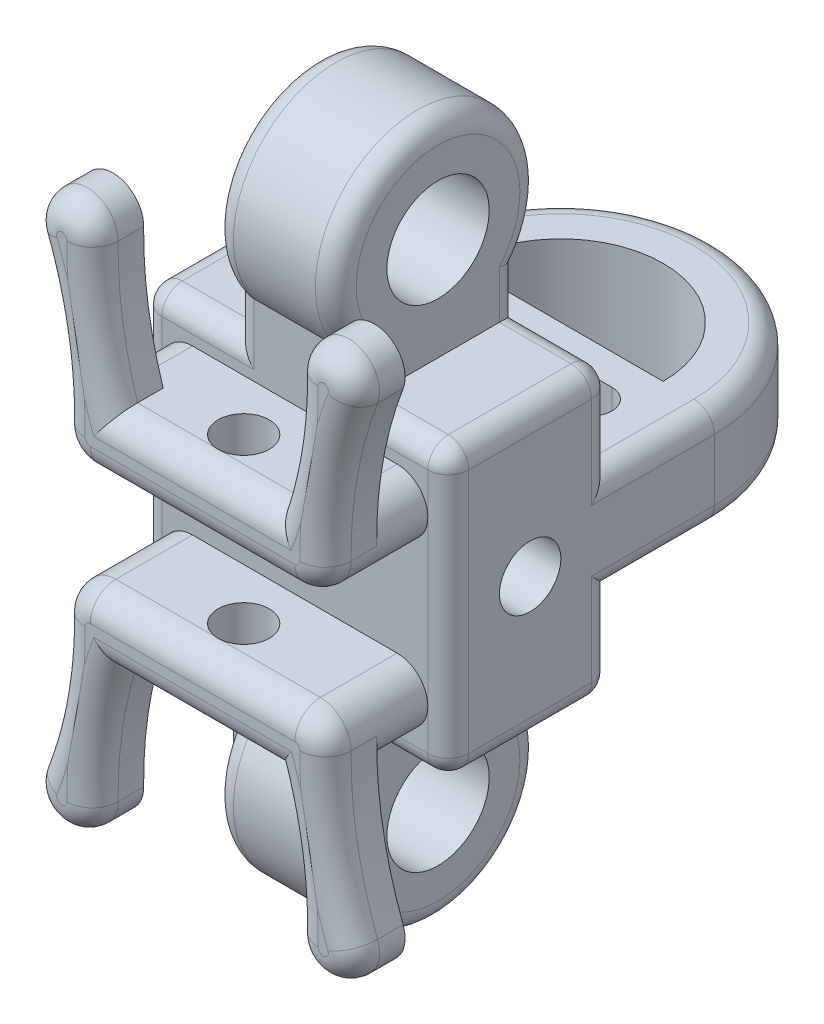
from build123d import *

# Parameters (mm, degrees)
SKETCH2_R           = 5
SKETCH2_R_2         = 2.5
BOSS_EXTRUDE2_DEPTH = 7.5
SKETCH3_W           = 4.5
SKETCH3_H           = 10
CUT_EXTRUDE1_DEPTH  = 7.5
SKETCH5_R           = 1.5
CUT_EXTRUDE3_DEPTH  = 27.286878856
SKETCH7_W           = 15
SKETCH7_H           = 5
BOSS_EXTRUDE3_DEPTH = 5
BOSS_EXTRUDE4_DEPTH = 5
CUT_EXTRUDE4_DEPTH  = 5
BOSS_EXTRUDE5_DEPTH = 2.5
BOSS_EXTRUDE6_DEPTH = 2.5
FILLET1_R           = 1
SKETCH12_R          = 1.25
CUT_EXTRUDE5_DEPTH  = 29.995503981
FILLET3_R           = 1.25


# Some blends are built 0.0001 mm under size
with BuildPart() as part:
    # Sketch2 → Boss-Extrude2 (new, symmetric)
    # profile 1 of 2: a face of its own
    with BuildSketch(Plane(origin=(0, 0, 0), x_dir=(0, 0, -1), z_dir=(1, 0, 0))):
        with Locations((0, 8)):
            Circle(SKETCH2_R)
        with Locations((0, 8)):
            Circle(SKETCH2_R_2, mode=Mode.SUBTRACT)
    # profile 2 of 2: a face of its own
    with BuildSketch(Plane(origin=(0, 0, 0), x_dir=(0, 0, -1), z_dir=(1, 0, 0))):
        with BuildLine():
            Line((-4, 5), (-4, -11))
            Line((-4, -11), (4, -11))
            Line((4, -11), (4, 5))
            ThreePointArc((4, 5), (0, 3), (-4, 5))
        make_face()
    boss_extrude2 = extrude(amount=BOSS_EXTRUDE2_DEPTH, both=True)

    # Sketch3 → Cut-Extrude1 (cut, symmetric)
    with BuildSketch(Plane.XY):
        with Locations((5.25, 8)):
            Rectangle(SKETCH3_W, SKETCH3_H)
        with Locations((-5.25, 8)):
            Rectangle(SKETCH3_W, SKETCH3_H)
    cut_extrude1 = extrude(amount=CUT_EXTRUDE1_DEPTH, both=True, mode=Mode.SUBTRACT)

    # Mirror1: Boss-Extrude2, Cut-Extrude1 across plane
    add(boss_extrude2.mirror(Plane(origin=(0, -4, 0), x_dir=(0, 0, 1), z_dir=(0, -1, 0))))
    add(cut_extrude1.mirror(Plane(origin=(0, -4, 0), x_dir=(0, 0, 1), z_dir=(0, -1, 0))), mode=Mode.SUBTRACT)

    # Sketch5 → Cut-Extrude3 (cut, through all)
    with BuildSketch(Plane.ZY.offset(7.5)):
        with Locations((0, -4)):
            Circle(SKETCH5_R)
    extrude(amount=-CUT_EXTRUDE3_DEPTH, mode=Mode.SUBTRACT)

    # Sketch7 → Boss-Extrude3 (add)
    with BuildSketch(Plane(origin=(0, 0, -4), x_dir=(-1, 0, 0), z_dir=(0, 0, -1))):
        with Locations((0, -4)):
            Rectangle(SKETCH7_W, SKETCH7_H)
    extrude(amount=BOSS_EXTRUDE3_DEPTH)

    # Sketch8 → Boss-Extrude4 (add)
    with BuildSketch(Plane(origin=(0, -1.5, 0), x_dir=(1, 0, 0), z_dir=(0, 1, 0))):
        with BuildLine():
            ThreePointArc((7.5, 9), (0, 16.5), (-7.5, 9))
            Line((-7.5, 9), (-5, 9))
            ThreePointArc((-5, 9), (0, 14), (5, 9))
            Line((5, 9), (7.5, 9))
        make_face()
    extrude(amount=-BOSS_EXTRUDE4_DEPTH)

    # Sketch9 → Cut-Extrude4 (cut)
    with BuildSketch(Plane(origin=(0, -1.5, 0), x_dir=(1, 0, 0), z_dir=(0, 1, 0))):
        with BuildLine():
            Line((4, 5.5), (-4, 5.5))
            ThreePointArc((-4, 5.5), (-5, 6.5), (-4, 7.5))
            Line((-4, 7.5), (4, 7.5))
            ThreePointArc((4, 7.5), (5, 6.5), (4, 5.5))
        make_face()
    extrude(amount=-CUT_EXTRUDE4_DEPTH, mode=Mode.SUBTRACT)

    # Sketch10 → Boss-Extrude5 (add)
    with BuildSketch(Plane.XY.offset(4)):
        with BuildLine():
            Line((5, -1.5), (-5, -1.5))
            ThreePointArc((-5, -1.5), (-6.5, 0), (-5, 1.5))
            Line((-5, 1.5), (5, 1.5))
            ThreePointArc((5, 1.5), (6.5, 0), (5, -1.5))
        make_face()
        with BuildLine():
            Line((5, -6.5), (-5, -6.5))
            ThreePointArc((-5, -6.5), (-6.5, -8), (-5, -9.5))
            Line((-5, -9.5), (5, -9.5))
            ThreePointArc((5, -9.5), (6.5, -8), (5, -6.5))
        make_face()
    extrude(amount=BOSS_EXTRUDE5_DEPTH)

    # Sketch11 → Boss-Extrude6 (add)
    with BuildSketch(Plane.XY.offset(6.5)):
        with BuildLine():
            ThreePointArc((-4.889304564, -15.859556619), (-4.669697958, -12.641193969), (-3.935541531, -9.5))
            Line((-3.935541531, -9.5), (3.935541531, -9.5))
            ThreePointArc((3.935541531, -9.5), (4.669697958, -12.641193969), (4.889304564, -15.859556619))
            ThreePointArc((4.889304564, -15.859556619), (6.649657688, -17.355673654), (7.792146365, -15.347707288))
            ThreePointArc((7.792146365, -15.347707288), (6.802137226, -11.743941032), (6.499880857, -8.018905405))
            ThreePointArc((6.499880857, -8.018905405), (6.067323313, -6.946045093), (5, -6.5))
            Line((5, -6.5), (-5, -6.5))
            ThreePointArc((-5, -6.5), (-6.067323313, -6.946045093), (-6.499880857, -8.018905405))
            ThreePointArc((-6.499880857, -8.018905405), (-6.802137226, -11.743941032), (-7.792146365, -15.347707288))
            ThreePointArc((-7.792146365, -15.347707288), (-6.649657688, -17.355673654), (-4.889304564, -15.859556619))
        make_face()
    boss_extrude6 = extrude(amount=BOSS_EXTRUDE6_DEPTH)

    # Mirror2: Boss-Extrude6 across plane
    add(boss_extrude6.mirror(Plane(origin=(0, -4, 0), x_dir=(0, 0, 1), z_dir=(0, -1, 0))))

    # Fillet1
    fillet1_edges = [part.edges().sort_by_distance(p)[0] for p in [
        (-7.5, -4, 4),
        (-7.5, -8.75, -4),
        (7.5, -4, 4),
        (7.5, -8.75, -4),
        (5.25, -11, 4),
        (7.5, -11, 0),
        (3, -21, 0),
        (3, -12, 4),
        (3, -12, -4),
        (5.25, -11, -4),
        (-7.5, -11, 0),
        (-5.25, -11, 4),
        (-3, -21, 0),
        (-3, -12, -4),
        (-5.25, -11, -4),
        (-7.5, 0.75, -4),
        (7.5, 0.75, -4),
        (-7.5, -6.5, -6.5),
        (-7.5, -1.5, -6.5),
        (7.5, -1.5, -6.5),
        (7.5, -6.5, -6.5),
        (0, -6.5, -16.5),
        (0, -1.5, -16.5),
        (-7.5, 3, 0),
        (7.5, 3, 0),
        (3, 4, -4),
        (3, 13, 0),
        (5.25, 3, -4),
        (-3, 13, 0),
        (-5.25, 3, -4),
        (3, 4, 4),
        (5.25, 3, 4),
        (-3, 4, 4),
        (-5.25, 3, 4),
    ]]
    fillet(fillet1_edges, radius=FILLET1_R - 0.0001)  # a hair under: the kernel refuses the full size

    # Sketch12 → Cut-Extrude5 (cut, through all)
    with BuildSketch(Plane(origin=(0, 1.5, 0), x_dir=(1, 0, 0), z_dir=(0, 1, 0))):
        with Locations(Location((0, -6.5, 0), (0, 0, 180))):
            Circle(SKETCH12_R)
    extrude(amount=-CUT_EXTRUDE5_DEPTH, mode=Mode.SUBTRACT)

    # Fillet3
    # the kernel refuses this fillet: 1.25 mm, written as the material it takes off along each edge
    with BuildSketch(Plane(origin=(5, -8, 9), x_dir=(0.9999205714331135, -0.012603603646399576, 0), z_dir=(-0.012603603646399576, -0.9999205714331135, 0))) as fillet3_piece_1:
        with BuildLine():
            CenterArc((1.5 - FILLET3_R, -FILLET3_R), FILLET3_R, 0, 90)
            Line((1.5 - FILLET3_R, 0), (1.5, 0))
            Line((1.5, 0), (1.5, -FILLET3_R))
        make_face()
    revolve(axis=Axis((5, -8, 9), (0, 0, 1)), revolution_arc=90.722152416, mode=Mode.SUBTRACT)
    with BuildSketch(Plane(origin=(-5, -8, 9), x_dir=(0, 1, 0), z_dir=(1, 0, 0))) as fillet3_piece_2:
        with BuildLine():
            CenterArc((1.5 - FILLET3_R, -FILLET3_R), FILLET3_R, 0, 90)
            Line((1.5 - FILLET3_R, 0), (1.5, 0))
            Line((1.5, 0), (1.5, -FILLET3_R))
        make_face()
    revolve(axis=Axis((-5, -8, 9), (0, 0, 1)), revolution_arc=90.722152416, mode=Mode.SUBTRACT)
    with BuildSketch(Plane(origin=(-6.389185421, -15.878462024, 9), x_dir=(-0.9353072960221611, 0.35383649049767807, 0), z_dir=(0.35383649049767807, 0.9353072960221611, 0))) as fillet3_piece_3:
        with BuildLine():
            CenterArc((1.5 - FILLET3_R, -FILLET3_R), FILLET3_R, 0, 90)
            Line((1.5, -FILLET3_R), (1.5, 0))
            Line((1.5, 0), (1.5 - FILLET3_R, 0))
        make_face()
    revolve(axis=Axis((-6.389185421, -15.878462024, 9), (0, 0, 1)), revolution_arc=201.444304831, mode=Mode.SUBTRACT)
    with BuildSketch(Plane(origin=(15.109106864, -15.607484546, 9), x_dir=(-0.9999205714331136, -0.01260360364639819, 0), z_dir=(0.01260360364639819, -0.9999205714331136, 0))) as fillet3_piece_4_section:
        with BuildLine():
            CenterArc((20 + FILLET3_R, FILLET3_R), FILLET3_R, 180, 90)
            Line((20 + FILLET3_R, 0), (20, 0))
            Line((20, 0), (20, FILLET3_R))
        make_face()
    fillet3_piece_4 = revolve(axis=Axis((15.109106864, -15.607484546, 9), (0, 0, -1)), revolution_arc=27.45544965, mode=Mode.PRIVATE)
    fillet3_piece_4 = split(fillet3_piece_4, bisect_by=Plane(origin=(-4.871523561, -9.5, 8.717024907), z_dir=(0, -1, 0)), keep=Keep.TOP, mode=Mode.PRIVATE)
    add(fillet3_piece_4, mode=Mode.SUBTRACT)
    with BuildSketch(Plane(origin=(-7.060541531, -9.5, 9), x_dir=(0, 0, -1), z_dir=(1, 0, 0))) as fillet3_piece_5_section:
        with BuildLine():
            CenterArc((FILLET3_R, FILLET3_R), FILLET3_R, 180, 90)
            Line((0, FILLET3_R), (0, 0))
            Line((0, 0), (FILLET3_R, 0))
        make_face()
    fillet3_piece_5 = extrude(amount=14.121083063, mode=Mode.PRIVATE)
    fillet3_piece_5 = fillet3_piece_5 & Plane(origin=(15.109106864, -15.607484546, 8.713182343), x_dir=(-0.9999205714331136, -0.01260360364639819, 0), z_dir=(0, 0, -1)) * Cylinder(20, 34, mode=Mode.PRIVATE)
    fillet3_piece_5 = fillet3_piece_5 & Plane(origin=(-15.109106864, -15.607484546, 8.713182343), x_dir=(0.95223241979576, 0.30537422728500113, 0), z_dir=(0, 0, -1)) * Cylinder(20, 34, mode=Mode.PRIVATE)
    add(fillet3_piece_5, mode=Mode.SUBTRACT)
    with BuildSketch(Plane(origin=(26.498292286, -8.270977478, 9), x_dir=(-0.9353072960221611, -0.3538364904976781, 0), z_dir=(0.3538364904976781, -0.9353072960221611, 0))) as fillet3_piece_6:
        with BuildLine():
            CenterArc((20 + FILLET3_R, FILLET3_R), FILLET3_R, 180, 90)
            Line((20, FILLET3_R), (20, 0))
            Line((20, 0), (20 + FILLET3_R, 0))
        make_face()
    revolve(axis=Axis((26.498292286, -8.270977478, 9), (0, 0, -1)), revolution_arc=21.444304831, mode=Mode.SUBTRACT)
    with BuildSketch(Plane(origin=(5, -6.5, 9), x_dir=(0, 0, -1), z_dir=(-1, 0, 0))) as fillet3_piece_7:
        with BuildLine():
            CenterArc((FILLET3_R, FILLET3_R), FILLET3_R, 180, 90)
            Line((0, FILLET3_R), (0, 0))
            Line((0, 0), (FILLET3_R, 0))
        make_face()
    extrude(amount=10, mode=Mode.SUBTRACT)
    with BuildSketch(Plane(origin=(-26.498292286, -8.270977478, 9), x_dir=(0.9999205714331136, 0.012603603646398205, 0), z_dir=(-0.012603603646398205, 0.9999205714331136, 0))) as fillet3_piece_8:
        with BuildLine():
            CenterArc((20 + FILLET3_R, FILLET3_R), FILLET3_R, 180, 90)
            Line((20, FILLET3_R), (20, 0))
            Line((20, 0), (20 + FILLET3_R, 0))
        make_face()
    revolve(axis=Axis((-26.498292286, -8.270977478, 9), (0, 0, -1)), revolution_arc=21.444304831, mode=Mode.SUBTRACT)
    with BuildSketch(Plane(origin=(-15.109106864, -15.607484546, 9), x_dir=(0.893110117374313, 0.44983810225862497, 0), z_dir=(-0.44983810225862497, 0.893110117374313, 0))) as fillet3_piece_9_section:
        with BuildLine():
            CenterArc((20 + FILLET3_R, FILLET3_R), FILLET3_R, 180, 90)
            Line((20, FILLET3_R), (20, 0))
            Line((20, 0), (20 + FILLET3_R, 0))
        make_face()
    fillet3_piece_9 = revolve(axis=Axis((-15.109106864, -15.607484546, 9), (0, 0, -1)), revolution_arc=27.45544965, mode=Mode.PRIVATE)
    fillet3_piece_9 = split(fillet3_piece_9, bisect_by=Plane(origin=(4.87152308, -9.5, 8.717024863), z_dir=(0, -1, 0)), keep=Keep.TOP, mode=Mode.PRIVATE)
    add(fillet3_piece_9, mode=Mode.SUBTRACT)
    with BuildSketch(Plane(origin=(6.389185421, -15.878462024, 9), x_dir=(-0.9999205714331135, 0.012603603646399576, 0), z_dir=(0.012603603646399576, 0.9999205714331135, 0))) as fillet3_piece_10:
        with BuildLine():
            CenterArc((1.5 - FILLET3_R, -FILLET3_R), FILLET3_R, 0, 90)
            Line((1.5, -FILLET3_R), (1.5, 0))
            Line((1.5, 0), (1.5 - FILLET3_R, 0))
        make_face()
    revolve(axis=Axis((6.389185421, -15.878462024, 9), (0, 0, 1)), revolution_arc=201.444304831, mode=Mode.SUBTRACT)
    with BuildSketch(Plane(origin=(-7.060541531, 1.5, 9), x_dir=(0, 0, -1), z_dir=(1, 0, 0))) as fillet3_piece_11_section:
        with BuildLine():
            CenterArc((FILLET3_R, -FILLET3_R), FILLET3_R, 90, 90)
            Line((0, -FILLET3_R), (0, 0))
            Line((0, 0), (FILLET3_R, 0))
        make_face()
    fillet3_piece_11 = extrude(amount=14.121083063, mode=Mode.PRIVATE)
    fillet3_piece_11 = fillet3_piece_11 & Plane(origin=(15.109106864, 7.607484546, 8.713182334), x_dir=(-0.9999205714331136, 0.01260360364639819, 0), z_dir=(0, 0, -1)) * Cylinder(20, 34, mode=Mode.PRIVATE)
    fillet3_piece_11 = fillet3_piece_11 & Plane(origin=(-15.109106864, 7.607484546, 8.713182334), x_dir=(0.95223241979576, -0.30537422728500113, 0), z_dir=(0, 0, -1)) * Cylinder(20, 34, mode=Mode.PRIVATE)
    add(fillet3_piece_11, mode=Mode.SUBTRACT)
    with BuildSketch(Plane(origin=(15.109106864, 7.607484546, 9), x_dir=(-0.9999205714331136, 0.01260360364639819, 0), z_dir=(0.01260360364639819, 0.9999205714331136, 0))) as fillet3_piece_12_section:
        with BuildLine():
            CenterArc((20 + FILLET3_R, -FILLET3_R), FILLET3_R, 90, 90)
            Line((20, -FILLET3_R), (20, 0))
            Line((20, 0), (20 + FILLET3_R, 0))
        make_face()
    fillet3_piece_12 = revolve(axis=Axis((15.109106864, 7.607484546, 9), (0, 0, 1)), revolution_arc=27.45544965, mode=Mode.PRIVATE)
    fillet3_piece_12 = split(fillet3_piece_12, bisect_by=Plane(origin=(-4.871523562, 1.5, 8.717024907), z_dir=(0, 1, 0)), keep=Keep.TOP, mode=Mode.PRIVATE)
    add(fillet3_piece_12, mode=Mode.SUBTRACT)
    with BuildSketch(Plane(origin=(-6.389185421, 7.878462024, 9), x_dir=(-0.9353072960221611, -0.35383649049767807, 0), z_dir=(0.35383649049767807, -0.9353072960221611, 0))) as fillet3_piece_13:
        with BuildLine():
            CenterArc((1.5 - FILLET3_R, FILLET3_R), FILLET3_R, 270, 90)
            Line((1.5, FILLET3_R), (1.5, 0))
            Line((1.5, 0), (1.5 - FILLET3_R, 0))
        make_face()
    revolve(axis=Axis((-6.389185421, 7.878462024, 9), (0, 0, -1)), revolution_arc=201.444304831, mode=Mode.SUBTRACT)
    with BuildSketch(Plane(origin=(-5, 0, 9), x_dir=(0, -1, 0), z_dir=(1, 0, 0))) as fillet3_piece_14:
        with BuildLine():
            CenterArc((1.5 - FILLET3_R, FILLET3_R), FILLET3_R, 270, 90)
            Line((1.5 - FILLET3_R, 0), (1.5, 0))
            Line((1.5, 0), (1.5, FILLET3_R))
        make_face()
    revolve(axis=Axis((-5, 0, 9), (0, 0, -1)), revolution_arc=90.722152416, mode=Mode.SUBTRACT)
    with BuildSketch(Plane(origin=(5, 0, 9), x_dir=(0.9999205714331135, 0.012603603646399583, 0), z_dir=(-0.012603603646399583, 0.9999205714331135, 0))) as fillet3_piece_15:
        with BuildLine():
            CenterArc((1.5 - FILLET3_R, FILLET3_R), FILLET3_R, 270, 90)
            Line((1.5 - FILLET3_R, 0), (1.5, 0))
            Line((1.5, 0), (1.5, FILLET3_R))
        make_face()
    revolve(axis=Axis((5, 0, 9), (0, 0, -1)), revolution_arc=90.722152416, mode=Mode.SUBTRACT)
    with BuildSketch(Plane(origin=(26.498292286, 0.270977478, 9), x_dir=(-0.9353072960221611, 0.3538364904976782, 0), z_dir=(0.3538364904976782, 0.9353072960221611, 0))) as fillet3_piece_16:
        with BuildLine():
            CenterArc((20 + FILLET3_R, -FILLET3_R), FILLET3_R, 90, 90)
            Line((20 + FILLET3_R, 0), (20, 0))
            Line((20, 0), (20, -FILLET3_R))
        make_face()
    revolve(axis=Axis((26.498292286, 0.270977478, 9), (0, 0, 1)), revolution_arc=21.444304831, mode=Mode.SUBTRACT)
    with BuildSketch(Plane(origin=(5, -1.5, 9), x_dir=(0, 0, -1), z_dir=(-1, 0, 0))) as fillet3_piece_17:
        with BuildLine():
            CenterArc((FILLET3_R, -FILLET3_R), FILLET3_R, 90, 90)
            Line((0, -FILLET3_R), (0, 0))
            Line((0, 0), (FILLET3_R, 0))
        make_face()
    extrude(amount=10, mode=Mode.SUBTRACT)
    with BuildSketch(Plane(origin=(6.389185421, 7.878462024, 9), x_dir=(-0.9999205714331135, -0.012603603646399576, 0), z_dir=(0.012603603646399576, -0.9999205714331135, 0))) as fillet3_piece_18:
        with BuildLine():
            CenterArc((1.5 - FILLET3_R, FILLET3_R), FILLET3_R, 270, 90)
            Line((1.5, FILLET3_R), (1.5, 0))
            Line((1.5, 0), (1.5 - FILLET3_R, 0))
        make_face()
    revolve(axis=Axis((6.389185421, 7.878462024, 9), (0, 0, -1)), revolution_arc=201.444304831, mode=Mode.SUBTRACT)
    with BuildSketch(Plane(origin=(-15.109106864, 7.607484546, 9), x_dir=(0.893110117374313, -0.44983810225862497, 0), z_dir=(-0.44983810225862497, -0.893110117374313, 0))) as fillet3_piece_19_section:
        with BuildLine():
            CenterArc((20 + FILLET3_R, -FILLET3_R), FILLET3_R, 90, 90)
            Line((20, -FILLET3_R), (20, 0))
            Line((20, 0), (20 + FILLET3_R, 0))
        make_face()
    fillet3_piece_19 = revolve(axis=Axis((-15.109106864, 7.607484546, 9), (0, 0, 1)), revolution_arc=27.45544965, mode=Mode.PRIVATE)
    fillet3_piece_19 = split(fillet3_piece_19, bisect_by=Plane(origin=(4.87152308, 1.5, 8.717024863), z_dir=(0, 1, 0)), keep=Keep.TOP, mode=Mode.PRIVATE)
    add(fillet3_piece_19, mode=Mode.SUBTRACT)
    with BuildSketch(Plane(origin=(-26.498292286, 0.270977478, 9), x_dir=(0.9999205714331136, -0.012603603646398205, 0), z_dir=(-0.012603603646398205, -0.9999205714331136, 0))) as fillet3_piece_20:
        with BuildLine():
            CenterArc((20 + FILLET3_R, -FILLET3_R), FILLET3_R, 90, 90)
            Line((20, -FILLET3_R), (20, 0))
            Line((20, 0), (20 + FILLET3_R, 0))
        make_face()
    revolve(axis=Axis((-26.498292286, 0.270977478, 9), (0, 0, 1)), revolution_arc=21.444304831, mode=Mode.SUBTRACT)
    with BuildSketch(Plane(origin=(-7.060541531, -9.5, 9), x_dir=(0, 0, -1), z_dir=(1, 0, 0))) as fillet3_piece_21a_section:
        with BuildLine():
            CenterArc((FILLET3_R, FILLET3_R), FILLET3_R, 180, 90)
            Line((0, FILLET3_R), (0, 0))
            Line((0, 0), (FILLET3_R, 0))
        make_face()
    fillet3_piece_21a = extrude(amount=14.121083063, mode=Mode.PRIVATE)
    fillet3_piece_21a = fillet3_piece_21a - Plane(origin=(15.109106864, -15.607484546, 8.721566138), x_dir=(-0.9999205714331136, -0.01260360364639819, 0), z_dir=(0, 0, -1)) * Cylinder(20, 34, mode=Mode.PRIVATE)
    with BuildSketch(Plane(origin=(15.109106864, -15.607484546, 9), x_dir=(-0.9999205714331136, -0.01260360364639819, 0), z_dir=(0.01260360364639819, -0.9999205714331136, 0))) as fillet3_piece_21b_section:
        with BuildLine():
            CenterArc((20 + FILLET3_R, FILLET3_R), FILLET3_R, 180, 90)
            Line((20 + FILLET3_R, 0), (20, 0))
            Line((20, 0), (20, FILLET3_R))
        make_face()
    fillet3_piece_21b = revolve(axis=Axis((15.109106864, -15.607484546, 9), (0, 0, -1)), revolution_arc=27.45544965, mode=Mode.PRIVATE)
    fillet3_piece_21b = split(fillet3_piece_21b, bisect_by=Plane(origin=(-3.66993862, -9.5, 8.723275277), z_dir=(0, 1, 0)), keep=Keep.TOP, mode=Mode.PRIVATE)
    fillet3_piece_21 = fillet3_piece_21a & fillet3_piece_21b
    add(fillet3_piece_21, mode=Mode.SUBTRACT)
    with BuildSketch(Plane(origin=(-7.060541531, -9.5, 9), x_dir=(0, 0, -1), z_dir=(1, 0, 0))) as fillet3_piece_22a_section:
        with BuildLine():
            CenterArc((FILLET3_R, FILLET3_R), FILLET3_R, 180, 90)
            Line((0, FILLET3_R), (0, 0))
            Line((0, 0), (FILLET3_R, 0))
        make_face()
    fillet3_piece_22a = extrude(amount=14.121083063, mode=Mode.PRIVATE)
    fillet3_piece_22a = fillet3_piece_22a - Plane(origin=(-15.109106864, -15.607484546, 8.721566529), x_dir=(0.95223241979576, 0.30537422728500113, 0), z_dir=(0, 0, -1)) * Cylinder(20, 34, mode=Mode.PRIVATE)
    with BuildSketch(Plane(origin=(-15.109106864, -15.607484546, 9), x_dir=(0.893110117374313, 0.44983810225862497, 0), z_dir=(-0.44983810225862497, 0.893110117374313, 0))) as fillet3_piece_22b_section:
        with BuildLine():
            CenterArc((20 + FILLET3_R, FILLET3_R), FILLET3_R, 180, 90)
            Line((20, FILLET3_R), (20, 0))
            Line((20, 0), (20 + FILLET3_R, 0))
        make_face()
    fillet3_piece_22b = revolve(axis=Axis((-15.109106864, -15.607484546, 9), (0, 0, -1)), revolution_arc=27.45544965, mode=Mode.PRIVATE)
    fillet3_piece_22b = split(fillet3_piece_22b, bisect_by=Plane(origin=(3.669939227, -9.5, 8.723275396), z_dir=(0, 1, 0)), keep=Keep.TOP, mode=Mode.PRIVATE)
    fillet3_piece_22 = fillet3_piece_22a & fillet3_piece_22b
    add(fillet3_piece_22, mode=Mode.SUBTRACT)
    with BuildSketch(Plane(origin=(-7.060541531, 1.5, 9), x_dir=(0, 0, -1), z_dir=(1, 0, 0))) as fillet3_piece_23a_section:
        with BuildLine():
            CenterArc((FILLET3_R, -FILLET3_R), FILLET3_R, 90, 90)
            Line((0, -FILLET3_R), (0, 0))
            Line((0, 0), (FILLET3_R, 0))
        make_face()
    fillet3_piece_23a = extrude(amount=14.121083063, mode=Mode.PRIVATE)
    fillet3_piece_23a = fillet3_piece_23a - Plane(origin=(15.109106864, 7.607484546, 8.721566149), x_dir=(-0.9999205714331136, 0.01260360364639819, 0), z_dir=(0, 0, -1)) * Cylinder(20, 34, mode=Mode.PRIVATE)
    with BuildSketch(Plane(origin=(15.109106864, 7.607484546, 9), x_dir=(-0.9999205714331136, 0.01260360364639819, 0), z_dir=(0.01260360364639819, 0.9999205714331136, 0))) as fillet3_piece_23b_section:
        with BuildLine():
            CenterArc((20 + FILLET3_R, -FILLET3_R), FILLET3_R, 90, 90)
            Line((20, -FILLET3_R), (20, 0))
            Line((20, 0), (20 + FILLET3_R, 0))
        make_face()
    fillet3_piece_23b = revolve(axis=Axis((15.109106864, 7.607484546, 9), (0, 0, 1)), revolution_arc=27.45544965, mode=Mode.PRIVATE)
    fillet3_piece_23b = split(fillet3_piece_23b, bisect_by=Plane(origin=(-3.66993862, 1.5, 8.723275277), z_dir=(0, -1, 0)), keep=Keep.TOP, mode=Mode.PRIVATE)
    fillet3_piece_23 = fillet3_piece_23a & fillet3_piece_23b
    add(fillet3_piece_23, mode=Mode.SUBTRACT)
    with BuildSketch(Plane(origin=(-7.060541531, 1.5, 9), x_dir=(0, 0, -1), z_dir=(1, 0, 0))) as fillet3_piece_24a_section:
        with BuildLine():
            CenterArc((FILLET3_R, -FILLET3_R), FILLET3_R, 90, 90)
            Line((0, -FILLET3_R), (0, 0))
            Line((0, 0), (FILLET3_R, 0))
        make_face()
    fillet3_piece_24a = extrude(amount=14.121083063, mode=Mode.PRIVATE)
    fillet3_piece_24a = fillet3_piece_24a - Plane(origin=(-15.109106864, 7.607484546, 8.721566523), x_dir=(0.95223241979576, -0.30537422728500113, 0), z_dir=(0, 0, -1)) * Cylinder(20, 34, mode=Mode.PRIVATE)
    with BuildSketch(Plane(origin=(-15.109106864, 7.607484546, 9), x_dir=(0.893110117374313, -0.44983810225862497, 0), z_dir=(-0.44983810225862497, -0.893110117374313, 0))) as fillet3_piece_24b_section:
        with BuildLine():
            CenterArc((20 + FILLET3_R, -FILLET3_R), FILLET3_R, 90, 90)
            Line((20, -FILLET3_R), (20, 0))
            Line((20, 0), (20 + FILLET3_R, 0))
        make_face()
    fillet3_piece_24b = revolve(axis=Axis((-15.109106864, 7.607484546, 9), (0, 0, 1)), revolution_arc=27.45544965, mode=Mode.PRIVATE)
    fillet3_piece_24b = split(fillet3_piece_24b, bisect_by=Plane(origin=(3.669939227, 1.5, 8.723275396), z_dir=(0, -1, 0)), keep=Keep.TOP, mode=Mode.PRIVATE)
    fillet3_piece_24 = fillet3_piece_24a & fillet3_piece_24b
    add(fillet3_piece_24, mode=Mode.SUBTRACT)


solid = part.part
